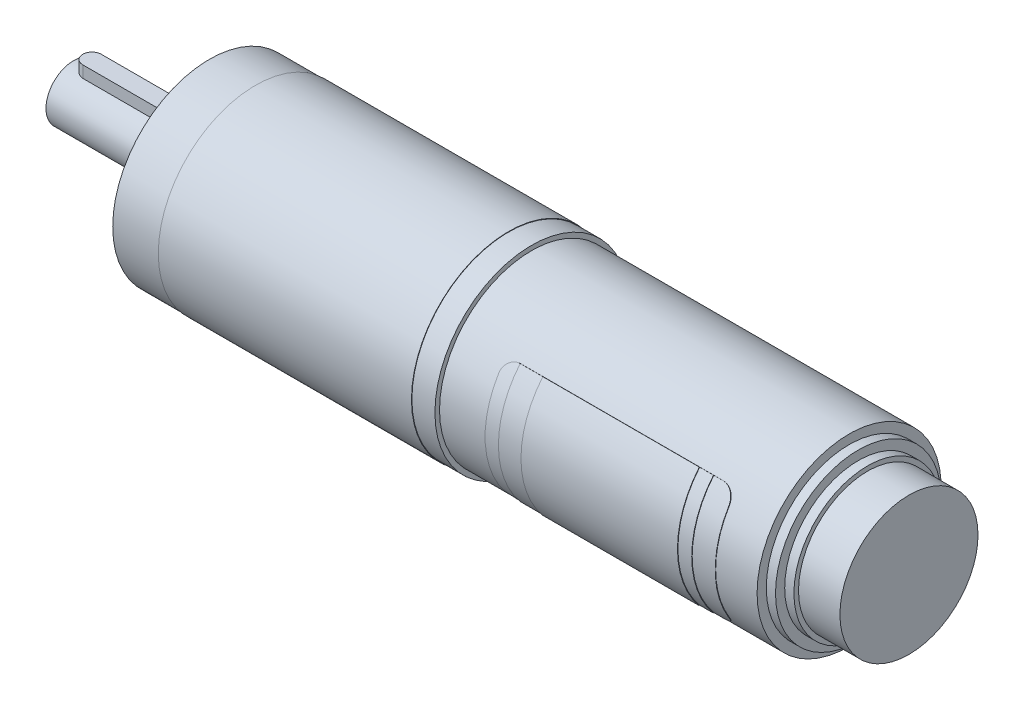
from build123d import *

# Parameters (mm, degrees)
SKETCH_2_R                     = 15
EXTRUDE_1_DEPTH                = 9
CUT_EXTRUDE_START              = 6
CUT_EXTRUDE_1_DEPTH            = 1.8
EXTRUDE_3_DEPTH                = 2.2
EXTRUDE_3_DEPTH_BACK           = 1.8
EXTRUDE_3_START                = 6
REVOLVE_2_ANGLE                = 40
REVOLVE_2_OTHER_WAY_ANGLE      = 40
FILLET_1_R                     = 3
HOLE_WIZARD_4_0_4_1_AT_2_COUNT = 2
HOLE_WIZARD_4_0_4_1_AT_2_PITCH = 24.748737342
HOLE_WIZARD_4_0_4_1_AT_3_COUNT = 2
HOLE_WIZARD_4_0_4_1_AT_3_PITCH = 35
HOLE_WIZARD_4_0_4_1_AT_4_COUNT = 2
HOLE_WIZARD_4_0_4_1_AT_4_PITCH = 24.748737342


with BuildPart() as part:
    # ｽｹｯﾁ1 → 回転1 (revolve)
    with BuildSketch(Plane.XY, mode=Mode.PRIVATE) as revolve_1_sk:
        Polygon((-99.5, 0), (-99.5, 6), (-73, 6), (-73, 14), (-70, 14), (-70, 21), (-60, 21), (-60, 21.1), (-5, 21.1), (-5, 21), (0, 21), (0, 20), (69, 20), (69, 18), (71, 18), (71, 16), (73, 16), (73, 0), align=None)
    revolve(revolve_1_sk.sketch.rotate(Axis((-67.500540801, 0, 0), (1, 0, 0)), 90), axis=Axis((-67.500540801, 0, 0), (1, 0, 0)))

    # ｽｹｯﾁ2 → ﾎﾞｽ - 押し出し1 (add)
    with BuildSketch(Plane(origin=(73, 0, 0), x_dir=(0, 0, -1), z_dir=(1, 0, 0))):
        with Locations(Location((0, 0, 0), (0, 0, 180))):
            Circle(SKETCH_2_R)
    extrude(amount=EXTRUDE_1_DEPTH)

    # ｽｹｯﾁ3 → ｶｯﾄ - 押し出し1 (cut)
    with BuildSketch(Plane(origin=(0, 0, 0), x_dir=(1, 0, 0), z_dir=(0, 1, 0)).offset(CUT_EXTRUDE_START)):
        with BuildLine():
            Line((-95.5, 2), (-79.5, 2))
            ThreePointArc((-79.5, 2), (-77.5, 0), (-79.5, -2))
            Line((-79.5, -2), (-95.5, -2))
            ThreePointArc((-95.5, -2), (-97.5, 0), (-95.5, 2))
        make_face()
    extrude(amount=-CUT_EXTRUDE_1_DEPTH, mode=Mode.SUBTRACT)

    # ｽｹｯﾁ7 → 回転2 (revolve)
    with BuildSketch(Plane(origin=(0, 0, 0), x_dir=(1, 0, 0), z_dir=(0, 1, 0))):
        Polygon((10, -20), (10, -20.1), (13, -20.1), (13, -20.2), (18, -20.2), (18, -20.3), (52, -20.3), (52, -20.2), (55, -20.2), (55, -20.1), (60, -20.1), (60, -20), align=None)
    revolve(axis=Axis((0, 0, 0), (1, 0, 0)), revolution_arc=REVOLVE_2_ANGLE)

    # ｽｹｯﾁ7 → 回転2 other way (revolve)
    with BuildSketch(Plane(origin=(0, 0, 0), x_dir=(1, 0, 0), z_dir=(0, 1, 0))):
        Polygon((10, -20), (10, -20.1), (13, -20.1), (13, -20.2), (18, -20.2), (18, -20.3), (52, -20.3), (52, -20.2), (55, -20.2), (55, -20.1), (60, -20.1), (60, -20), align=None)
    revolve(axis=Axis((0, 0, 0), (-1, 0, 0)), revolution_arc=REVOLVE_2_OTHER_WAY_ANGLE)

    # ﾌｨﾚｯﾄ1
    # the kernel refuses this fillet: 3 mm, written as the material it takes off along each edge
    with BuildSketch(Plane(origin=(10, -8.034845121, 9.575555539), x_dir=(1, 0, 0), z_dir=(-1.7763568394002255e-14, -0.6427876096865406, 0.7660444431189771))) as fillet_1_piece_1_section:
        with BuildLine():
            CenterArc((FILLET_1_R, FILLET_1_R), FILLET_1_R, 180, 90)
            Line((0, FILLET_1_R), (0, 0))
            Line((0, 0), (FILLET_1_R, 0))
        make_face()
    fillet_1_piece_1 = extrude(amount=15.1, mode=Mode.PRIVATE)
    fillet_1_piece_1 = fillet_1_piece_1 - Plane(origin=(10.677750836, 0, 0), x_dir=(0, 0, 1), z_dir=(1, 0, 0)) * Cylinder(20, 43, mode=Mode.PRIVATE)
    add(fillet_1_piece_1, mode=Mode.SUBTRACT)
    with BuildSketch(Plane(origin=(60, -17.740938027, 21.14282663), x_dir=(0, 0.766044443118977, 0.6427876096865406), z_dir=(-7.105427357601155e-14, 0.6427876096865406, -0.7660444431189771))) as fillet_1_piece_2_section:
        with BuildLine():
            CenterArc((FILLET_1_R, -FILLET_1_R), FILLET_1_R, 90, 90)
            Line((0, -FILLET_1_R), (0, 0))
            Line((0, 0), (FILLET_1_R, 0))
        make_face()
    fillet_1_piece_2 = extrude(amount=15.1, mode=Mode.PRIVATE)
    fillet_1_piece_2 = fillet_1_piece_2 - Plane(origin=(59.322254473, 0, 0), x_dir=(0, 0, 1), z_dir=(1, 0, 0)) * Cylinder(20, 43, mode=Mode.PRIVATE)
    add(fillet_1_piece_2, mode=Mode.SUBTRACT)
    with BuildSketch(Plane(origin=(10, 8.034845121, 9.575555539), x_dir=(1, 0, 0), z_dir=(-1.7763568394002255e-14, 0.6427876096865406, 0.7660444431189771))) as fillet_1_piece_3_section:
        with BuildLine():
            CenterArc((FILLET_1_R, -FILLET_1_R), FILLET_1_R, 90, 90)
            Line((0, -FILLET_1_R), (0, 0))
            Line((0, 0), (FILLET_1_R, 0))
        make_face()
    fillet_1_piece_3 = extrude(amount=15.1, mode=Mode.PRIVATE)
    fillet_1_piece_3 = fillet_1_piece_3 - Plane(origin=(10.677751865, 0, 0), x_dir=(0, 0, 1), z_dir=(1, 0, 0)) * Cylinder(20, 43, mode=Mode.PRIVATE)
    add(fillet_1_piece_3, mode=Mode.SUBTRACT)
    with BuildSketch(Plane(origin=(60, 17.740938027, 21.14282663), x_dir=(-1, 0, 0), z_dir=(-7.105427357601155e-14, -0.6427876096865406, -0.7660444431189771))) as fillet_1_piece_4_section:
        with BuildLine():
            CenterArc((FILLET_1_R, -FILLET_1_R), FILLET_1_R, 90, 90)
            Line((0, -FILLET_1_R), (0, 0))
            Line((0, 0), (FILLET_1_R, 0))
        make_face()
    fillet_1_piece_4 = extrude(amount=15.1, mode=Mode.PRIVATE)
    fillet_1_piece_4 = fillet_1_piece_4 - Plane(origin=(59.322248135, 0, 0), x_dir=(0, 0, 1), z_dir=(1, 0, 0)) * Cylinder(20, 43, mode=Mode.PRIVATE)
    add(fillet_1_piece_4, mode=Mode.SUBTRACT)

    # ｽｹｯﾁ9 → Ø4.0 (4) 直径の穴1 (revolve, cut)
    with BuildSketch(Plane(origin=(-70, 17.5, 0), x_dir=(0, 0, 1), z_dir=(0, 1, 0))):
        Polygon((0, 0), (0, 7.201721238), (2, 6), (2, 0), align=None)
    hole_wizard_4_0_4_1 = revolve(axis=Axis((-76.35, 17.5, 0), (1, 0, 0)), mode=Mode.SUBTRACT)

    # Ø4.0 (4) 直径の穴1 at 2: Ø4.0 (4) 直径の穴1 ×2
    with Locations(*[Vector(0, -0.7071067811865476, -0.7071067811865476) * (i * HOLE_WIZARD_4_0_4_1_AT_2_PITCH) for i in range(1, HOLE_WIZARD_4_0_4_1_AT_2_COUNT)]):
        add(hole_wizard_4_0_4_1, mode=Mode.SUBTRACT)

    # Ø4.0 (4) 直径の穴1 at 3: Ø4.0 (4) 直径の穴1 ×2
    with Locations(*[(0, -i * HOLE_WIZARD_4_0_4_1_AT_3_PITCH, 0) for i in range(1, HOLE_WIZARD_4_0_4_1_AT_3_COUNT)]):
        add(hole_wizard_4_0_4_1, mode=Mode.SUBTRACT)

    # Ø4.0 (4) 直径の穴1 at 4: Ø4.0 (4) 直径の穴1 ×2
    with Locations(*[Vector(0, -0.7071067811865476, 0.7071067811865476) * (i * HOLE_WIZARD_4_0_4_1_AT_4_PITCH) for i in range(1, HOLE_WIZARD_4_0_4_1_AT_4_COUNT)]):
        add(hole_wizard_4_0_4_1, mode=Mode.SUBTRACT)


with BuildPart() as body_2:
    # ｽｹｯﾁ3<2> → ﾎﾞｽ - 押し出し3 (new, two sides: drawn at the far end of the back side and taken through both)
    with BuildSketch(Plane(origin=(0, 0, 0), x_dir=(1, 0, 0), z_dir=(0, 1, 0)).offset(EXTRUDE_3_START - EXTRUDE_3_DEPTH_BACK)):
        with BuildLine():
            Line((-95.5, 2), (-79.5, 2))
            ThreePointArc((-79.5, 2), (-77.5, 0), (-79.5, -2))
            Line((-79.5, -2), (-95.5, -2))
            ThreePointArc((-95.5, -2), (-97.5, 0), (-95.5, 2))
        make_face()
    extrude(amount=EXTRUDE_3_DEPTH + EXTRUDE_3_DEPTH_BACK)


solid = Compound([part.part, body_2.part])
